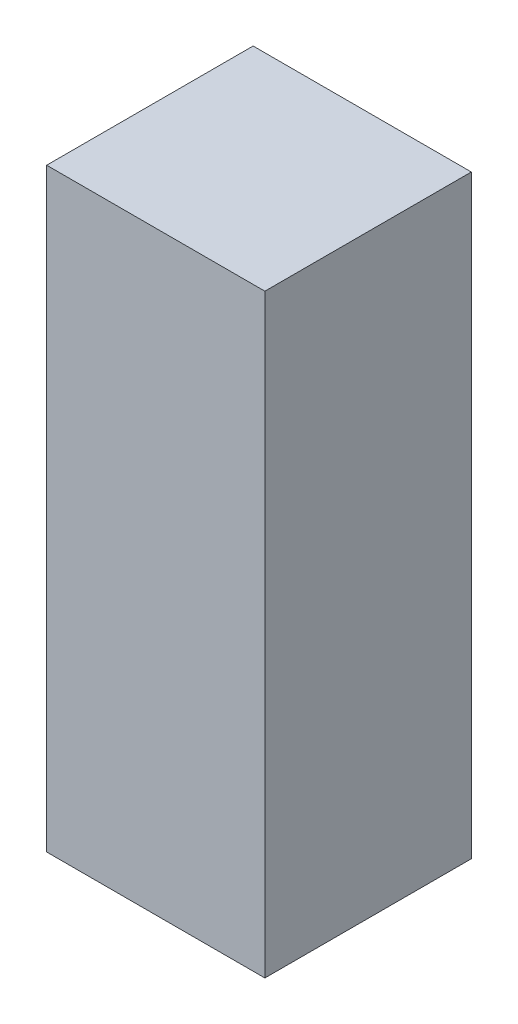
from build123d import *

# Parameters (mm, degrees)
SKETCH1_W           = 20.25
SKETCH1_H           = 19.16
BOSS_EXTRUDE1_DEPTH = 55.2


with BuildPart() as part:
    # Sketch1 → Boss-Extrude1 (new body)
    with BuildSketch(Plane(origin=(0, 0, 0), x_dir=(1, 0, 0), z_dir=(0, 1, 0))):
        Rectangle(SKETCH1_W, SKETCH1_H)
    extrude(amount=-BOSS_EXTRUDE1_DEPTH)


solid = part.part
